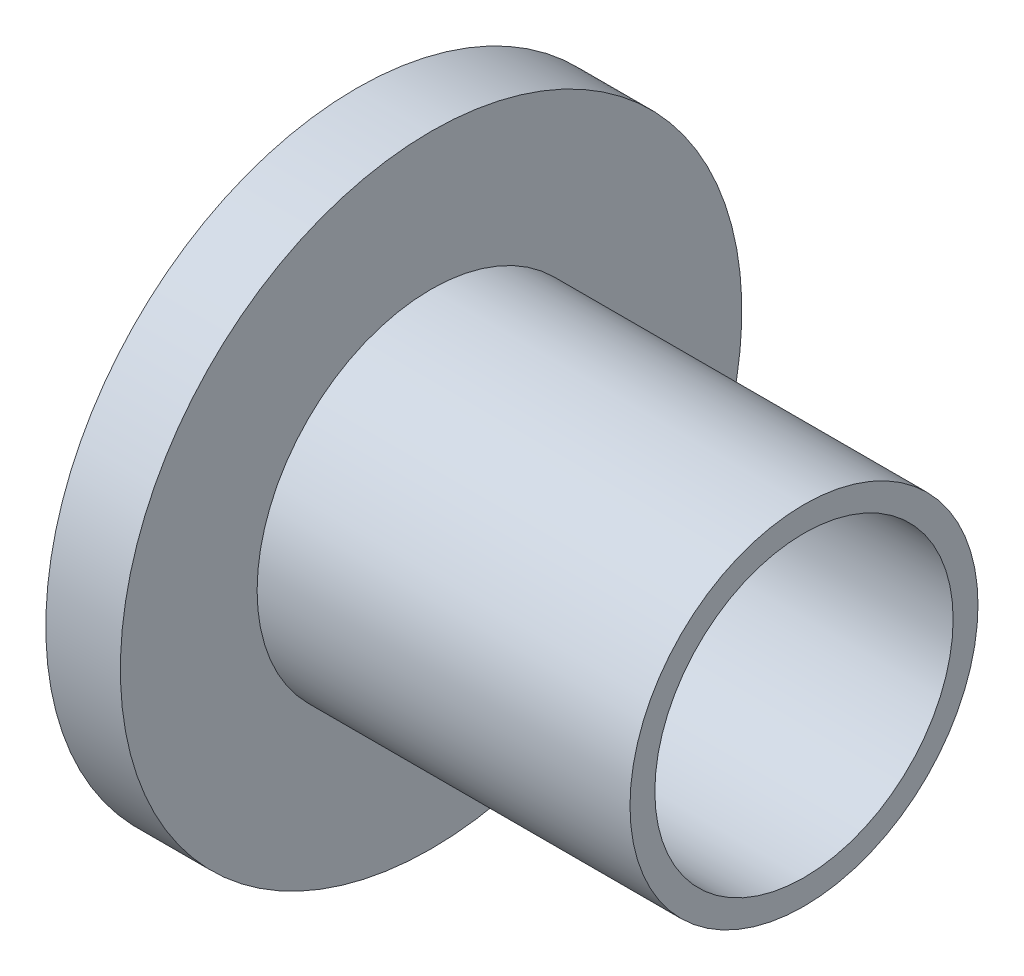
from build123d import *


with BuildPart() as part:
    # Sketch1 → Revolve1 (revolve)
    with BuildSketch(Plane.XY):
        Polygon((-6, 25), (-6, 7.5), (-16, 7.5), (-16, 5.5), (-3, 5.5), (-3, 10), (0, 10), (0, 12), (30, 12), (30, 14), (0, 14), (0, 25), align=None)
    revolve(axis=Axis((-64.900117457, 0, 0), (1, 0, 0)))


solid = part.part
